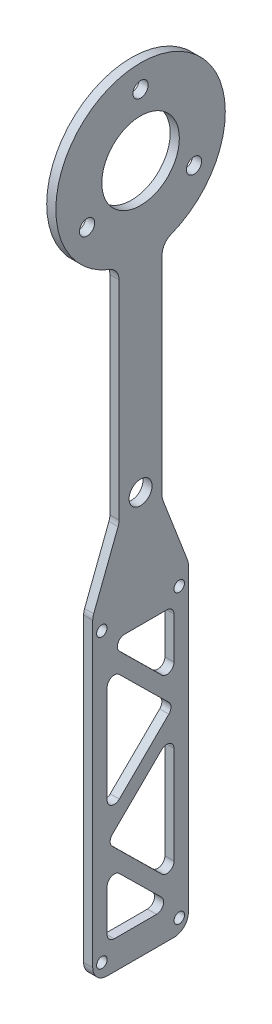
from build123d import *

# Parameters (mm, degrees)
SKETCH1_R           = 1.8288
SKETCH1_R_2         = 4
SKETCH1_R_3         = 13.5
SKETCH1_R_4         = 2.65
BOSS_EXTRUDE1_DEPTH = 3.175
CUT_EXTRUDE1_REACH  = 169.154
SKETCH2_W           = 4.112404804
SKETCH2_H           = 134.435584328
FILLET3_R           = 2.5
FILLET4_R           = 5


with BuildPart() as part:
    # Sketch1 → Boss-Extrude1 (new body)
    with BuildSketch(Plane(origin=(0, 0, 0), x_dir=(0, 0, -1), z_dir=(1, 0, 0))):
        with BuildLine():
            Line((20.757404804, -105), (20.757404804, -5))
            Line((20.757404804, -5), (7.5, 29.435584328))
            Line((7.5, 29.435584328), (7.5, 106.469314765))
            ThreePointArc((7.5, 106.469314765), (0, 164.5), (-7.5, 106.469314765))
            Line((-7.5, 106.469314765), (-7.5, 29.435584328))
            Line((-7.5, 29.435584328), (-20.757404804, -5))
            Line((-20.757404804, -5), (-20.757404804, -105))
            Line((-20.757404804, -105), (20.757404804, -105))
        make_face()
        with Locations((-13.4747, -100)):
            Circle(SKETCH1_R, mode=Mode.SUBTRACT)
        with Locations((13.4747, -100)):
            Circle(SKETCH1_R, mode=Mode.SUBTRACT)
        with Locations((13.4747, 0)):
            Circle(SKETCH1_R, mode=Mode.SUBTRACT)
        with Locations((-13.4747, 0)):
            Circle(SKETCH1_R, mode=Mode.SUBTRACT)
        with Locations((0, 35)):
            Circle(SKETCH1_R_2, mode=Mode.SUBTRACT)
        with Locations((0, 135)):
            Circle(SKETCH1_R_3, mode=Mode.SUBTRACT)
        with Locations((18.619546181, 124.25)):
            Circle(SKETCH1_R_4, mode=Mode.SUBTRACT)
        with Locations((0, 156.5)):
            Circle(SKETCH1_R_4, mode=Mode.SUBTRACT)
        with Locations((-18.619546181, 124.25)):
            Circle(SKETCH1_R_4, mode=Mode.SUBTRACT)
    extrude(amount=BOSS_EXTRUDE1_DEPTH)

    # Sketch2 → Cut-Extrude1 (cut, up to next)
    with BuildSketch(Plane(origin=(3.175, 0, 0), x_dir=(0, 0, -1), z_dir=(1, 0, 0)), mode=Mode.PRIVATE) as cut_extrude1_sk1:
        Polygon((11.645, -5), (-11.645, -5), (11.645, -27.976379872), align=None)
    cut_extrude1_tool1 = extrude(cut_extrude1_sk1.sketch, amount=-CUT_EXTRUDE1_REACH, mode=Mode.PRIVATE) & part.part
    # Sketch2 → Cut-Extrude1 (cut, up to next)
    with BuildSketch(Plane(origin=(3.175, 0, 0), x_dir=(0, 0, -1), z_dir=(1, 0, 0)), mode=Mode.PRIVATE) as cut_extrude1_sk2:
        Polygon((-11.645, -12.023620128), (11.645, -35), (-11.645, -57.976379872), (-11.645, -35), align=None)
    cut_extrude1_tool2 = extrude(cut_extrude1_sk2.sketch, amount=-CUT_EXTRUDE1_REACH, mode=Mode.PRIVATE) & part.part
    # Sketch2 → Cut-Extrude1 (cut, up to next)
    with BuildSketch(Plane(origin=(3.175, 0, 0), x_dir=(0, 0, -1), z_dir=(1, 0, 0)), mode=Mode.PRIVATE) as cut_extrude1_sk3:
        Polygon((-11.645, -72.023620128), (-11.645, -95), (11.645, -95), align=None)
    cut_extrude1_tool3 = extrude(cut_extrude1_sk3.sketch, amount=-CUT_EXTRUDE1_REACH, mode=Mode.PRIVATE) & part.part
    # Sketch2 → Cut-Extrude1 (cut, up to next)
    with BuildSketch(Plane(origin=(3.175, 0, 0), x_dir=(0, 0, -1), z_dir=(1, 0, 0)), mode=Mode.PRIVATE) as cut_extrude1_sk4:
        Polygon((11.645, -42.023620128), (11.645, -65), (11.645, -87.976379872), (-11.645, -65), align=None)
    cut_extrude1_tool4 = extrude(cut_extrude1_sk4.sketch, amount=-CUT_EXTRUDE1_REACH, mode=Mode.PRIVATE) & part.part
    # Sketch2 → Cut-Extrude1 (cut, up to next)
    with BuildSketch(Plane(origin=(3.175, 0, 0), x_dir=(0, 0, -1), z_dir=(1, 0, 0)), mode=Mode.PRIVATE) as cut_extrude1_sk5:
        with Locations((-18.701202402, -37.782207836)):
            Rectangle(SKETCH2_W, SKETCH2_H)
    cut_extrude1_tool5 = extrude(cut_extrude1_sk5.sketch, amount=-CUT_EXTRUDE1_REACH, mode=Mode.PRIVATE) & part.part
    # Sketch2 → Cut-Extrude1 (cut, up to next)
    with BuildSketch(Plane(origin=(3.175, 0, 0), x_dir=(0, 0, -1), z_dir=(1, 0, 0)), mode=Mode.PRIVATE) as cut_extrude1_sk6:
        with Locations((18.701202402, -37.782207836)):
            Rectangle(SKETCH2_W, SKETCH2_H)
    cut_extrude1_tool6 = extrude(cut_extrude1_sk6.sketch, amount=-CUT_EXTRUDE1_REACH, mode=Mode.PRIVATE) & part.part
    add(cut_extrude1_tool1.solids().sort_by_distance((3.175, -12.658793, -3.881667))[0], mode=Mode.SUBTRACT)
    add(cut_extrude1_tool2.solids().sort_by_distance((3.175, -35, 3.881667))[0], mode=Mode.SUBTRACT)
    add(cut_extrude1_tool3.solids().sort_by_distance((3.175, -87.341207, 3.881667))[0], mode=Mode.SUBTRACT)
    add(cut_extrude1_tool4.solids().sort_by_distance((3.175, -65, -3.881667))[0], mode=Mode.SUBTRACT)
    add(cut_extrude1_tool5.solids().sort_by_distance((3.175, -37.782208, 18.701202))[0], mode=Mode.SUBTRACT)
    add(cut_extrude1_tool6.solids().sort_by_distance((3.175, -37.782208, -18.701202))[0], mode=Mode.SUBTRACT)

    # Fillet3
    fillet3_edges = [part.edges().sort_by_distance(p)[0] for p in [
        (1.5875, -57.976379872, 11.645),
        (1.5875, -35, -11.645),
        (1.5875, -95, -11.645),
        (1.5875, -72.023620128, 11.645),
        (1.5875, -95, 11.645),
        (1.5875, -27.976379872, -11.645),
        (1.5875, -5, -11.645),
        (1.5875, -12.023620128, 11.645),
        (1.5875, -5, 11.645),
        (1.5875, -87.976379872, -11.645),
        (1.5875, -42.023620128, -11.645),
        (1.5875, -65, 11.645),
    ]]
    fillet(fillet3_edges, radius=FILLET3_R)

    # Fillet4
    fillet4_edges = [part.edges().sort_by_distance(p)[0] for p in [
        (1.5875, 29.435584328, -7.5),
        (1.5875, 29.435584328, 7.5),
        (1.5875, -105, -16.645),
        (1.5875, -105, 16.645),
        (1.5875, 5.681808734, 16.645),
        (1.5875, 5.681808734, -16.645),
        (1.5875, 106.469314765, -7.5),
        (1.5875, 106.469314765, 7.5),
    ]]
    fillet(fillet4_edges, radius=FILLET4_R)


solid = part.part
